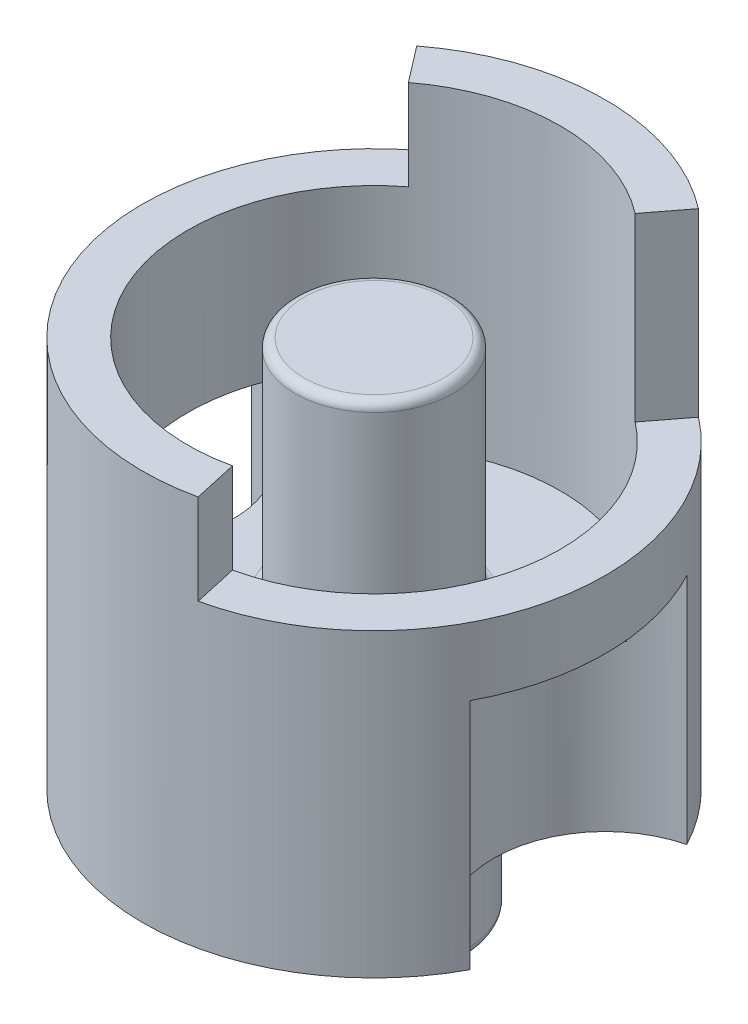
from build123d import *

# Parameters (mm, degrees)
SKETCH1_R           = 6.50875
BOSS_EXTRUDE1_DEPTH = 13.5382
SKETCH2_R           = 2.54
BOSS_EXTRUDE2_DEPTH = 2.921
CUT_EXTRUDE1_START  = -2.54
CUT_EXTRUDE1_DEPTH  = 2.54
CUT_EXTRUDE2_START  = -2.54
SKETCH4_R           = 2.2225
CUT_EXTRUDE2_DEPTH  = 2.54
CUT_EXTRUDE3_START  = -3.81
SKETCH5_R           = 5.23875
SKETCH5_R_2         = 2.2225
CUT_EXTRUDE3_DEPTH  = 3.81
CUT_EXTRUDE4_DEPTH  = 6.5532


with BuildPart() as part:
    # Sketch1 → Boss-Extrude1 (new body)
    with BuildSketch(Plane(origin=(0, 0, 0), x_dir=(1, 0, 0), z_dir=(0, 1, 0))):
        with Locations(Location((0, 0, 0), (0, 0, 270))):
            Circle(SKETCH1_R)
    extrude(amount=BOSS_EXTRUDE1_DEPTH)

    # Sketch2 → Boss-Extrude2 (add)
    with BuildSketch(Plane.XZ):
        with Locations(Location((0, 0, 0), (0, 0, 270))):
            Circle(SKETCH2_R)
    extrude(amount=BOSS_EXTRUDE2_DEPTH)

    # Sketch3 → Cut-Extrude1 (cut)
    with BuildSketch(Plane(origin=(0, 13.5382, 0), x_dir=(1, 0, 0), z_dir=(0, 1, 0)).offset(CUT_EXTRUDE1_START)):
        with BuildLine():
            Line((-3.189148936, 4.156179811), (-3.962275951, 5.163738554))
            ThreePointArc((-3.962275951, 5.163738554), (0, -6.50875), (3.962275951, 5.163738554))
            Line((3.962275951, 5.163738554), (3.189148936, 4.156179811))
            ThreePointArc((3.189148936, 4.156179811), (0, 5.23875), (-3.189148936, 4.156179811))
        make_face()
    extrude(amount=CUT_EXTRUDE1_DEPTH, mode=Mode.SUBTRACT)

    # Sketch4 → Cut-Extrude2 (cut)
    with BuildSketch(Plane(origin=(0, 10.9982, 0), x_dir=(1, 0, 0), z_dir=(0, 1, 0)).offset(CUT_EXTRUDE2_START)):
        with BuildLine():
            Line((3.962275951, 5.163738554), (3.189148936, 4.156179811))
            ThreePointArc((3.189148936, 4.156179811), (-5.114570707, 1.133873028), (1.133873028, -5.114570707))
            Line((1.133873028, -5.114570707), (1.408751337, -6.354466636))
            ThreePointArc((1.408751337, -6.354466636), (6.354466636, -1.408751337), (3.962275951, 5.163738554))
        make_face()
        with Locations(Location((0, 0, 0), (0, 0, 270))):
            Circle(SKETCH4_R, mode=Mode.SUBTRACT)
    extrude(amount=CUT_EXTRUDE2_DEPTH, mode=Mode.SUBTRACT)

    # Sketch5 → Cut-Extrude3 (cut)
    with BuildSketch(Plane(origin=(0, 8.4582, 0), x_dir=(1, 0, 0), z_dir=(0, 1, 0)).offset(CUT_EXTRUDE3_START)):
        with Locations(Location((0, 0, 0), (0, 0, 270))):
            Circle(SKETCH5_R)
        with Locations(Location((0, 0, 0), (0, 0, 270))):
            Circle(SKETCH5_R_2, mode=Mode.SUBTRACT)
    extrude(amount=CUT_EXTRUDE3_DEPTH, mode=Mode.SUBTRACT)

    # Sketch6 → Cut-Extrude4 (cut)
    with BuildSketch(Plane.XZ):
        with BuildLine():
            ThreePointArc((5.750958404, 3.048), (3.367961548, 0), (5.750958404, -3.048))
            ThreePointArc((5.750958404, -3.048), (6.50875, 0), (5.750958404, 3.048))
        make_face()
        with BuildLine():
            ThreePointArc((-5.992681083, 2.54), (-3.916853566, 0), (-5.992681083, -2.54))
            ThreePointArc((-5.992681083, -2.54), (-6.50875, 0), (-5.992681083, 2.54))
        make_face()
    extrude(amount=-CUT_EXTRUDE4_DEPTH, mode=Mode.SUBTRACT)

    # Fillet2: read off the stored shape, not the designer's step
    # Fillet2 outline → Fillet2 (revolve, cut)
    with BuildSketch(Plane.XY):
        with BuildLine():
            ThreePointArc((1.9685, 10.9982), (2.148105122, 10.923805122), (2.2225, 10.7442))
            Line((2.2225, 10.7442), (2.2225, 10.9982))
            Line((2.2225, 10.9982), (1.9685, 10.9982))
        make_face()
        with BuildLine():
            Line((2.54, -2.921), (2.54, -2.667))
            ThreePointArc((2.54, -2.667), (2.465605122, -2.846605122), (2.286, -2.921))
            Line((2.286, -2.921), (2.54, -2.921))
        make_face()
    revolve(axis=Axis((0, 0, 0), (0, 1, 0)), mode=Mode.SUBTRACT)

    # Fillet2 2 outline → Fillet2 2 (revolve)
    with BuildSketch(Plane.XY):
        with BuildLine():
            Line((2.2225, 4.9022), (2.2225, 4.6482))
            Line((2.2225, 4.6482), (2.4765, 4.6482))
            ThreePointArc((2.4765, 4.6482), (2.296894878, 4.722594878), (2.2225, 4.9022))
        make_face()
    revolve(axis=Axis((0, 0, 0), (0, 1, 0)))


solid = part.part
